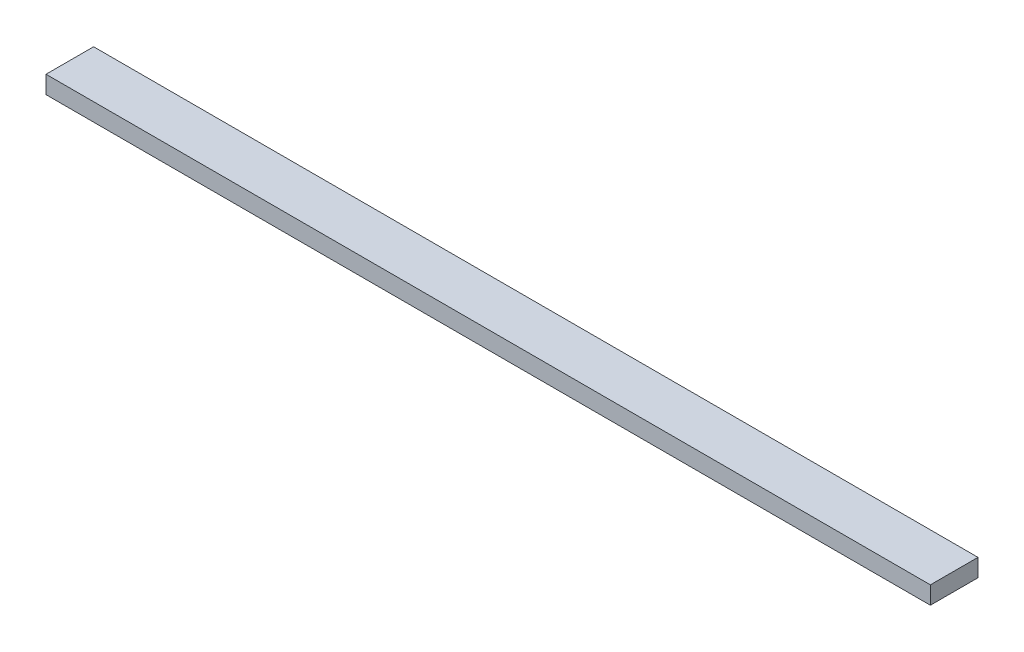
from build123d import *

# Parameters (mm, degrees)
SKETCH1_W           = 250
SKETCH1_H           = 13.462
BOSS_EXTRUDE1_DEPTH = 5


with BuildPart() as part:
    # Sketch1 → Boss-Extrude1 (new body)
    with BuildSketch(Plane(origin=(0, 0, 0), x_dir=(1, 0, 0), z_dir=(0, 1, 0))):
        Rectangle(SKETCH1_W, SKETCH1_H)
    extrude(amount=BOSS_EXTRUDE1_DEPTH)


solid = part.part
